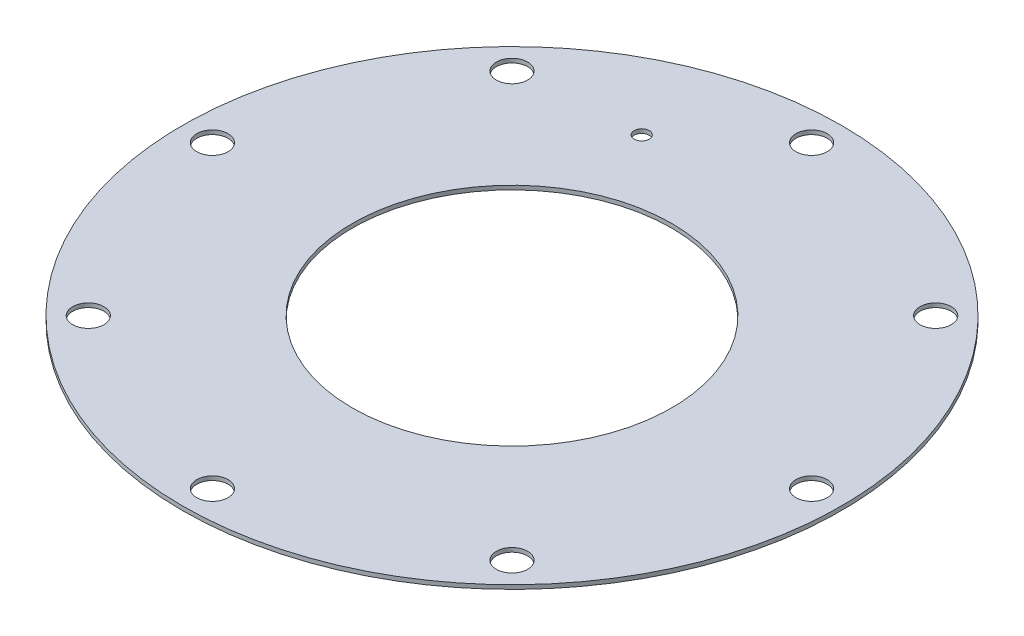
from build123d import *

# Parameters (mm, degrees)
SKETCH1_R           = 69.85
SKETCH1_R_2         = 33.8636
SKETCH1_R_3         = 3.3147
SKETCH1_R_4         = 1.5875
BOSS_EXTRUDE1_DEPTH = 0.8636


with BuildPart() as part:
    # Sketch1 → Boss-Extrude1 (new body)
    with BuildSketch(Plane(origin=(0, 0, 0), x_dir=(1, 0, 0), z_dir=(0, 1, 0))):
        Circle(SKETCH1_R)
        Circle(SKETCH1_R_2, mode=Mode.SUBTRACT)
        with Locations((0, 63.5)):
            Circle(SKETCH1_R_3, mode=Mode.SUBTRACT)
        with Locations((44.901280605, 44.901280605)):
            Circle(SKETCH1_R_3, mode=Mode.SUBTRACT)
        with Locations((63.5, 0)):
            Circle(SKETCH1_R_3, mode=Mode.SUBTRACT)
        with Locations((44.901280605, -44.901280605)):
            Circle(SKETCH1_R_3, mode=Mode.SUBTRACT)
        with Locations((0, -63.5)):
            Circle(SKETCH1_R_3, mode=Mode.SUBTRACT)
        with Locations((-44.901280605, -44.901280605)):
            Circle(SKETCH1_R_3, mode=Mode.SUBTRACT)
        with Locations((-63.5, 0)):
            Circle(SKETCH1_R_3, mode=Mode.SUBTRACT)
        with Locations((-44.901280605, 44.901280605)):
            Circle(SKETCH1_R_3, mode=Mode.SUBTRACT)
        with Locations((-19.440318364, 46.933080252)):
            Circle(SKETCH1_R_4, mode=Mode.SUBTRACT)
    extrude(amount=BOSS_EXTRUDE1_DEPTH)


solid = part.part
